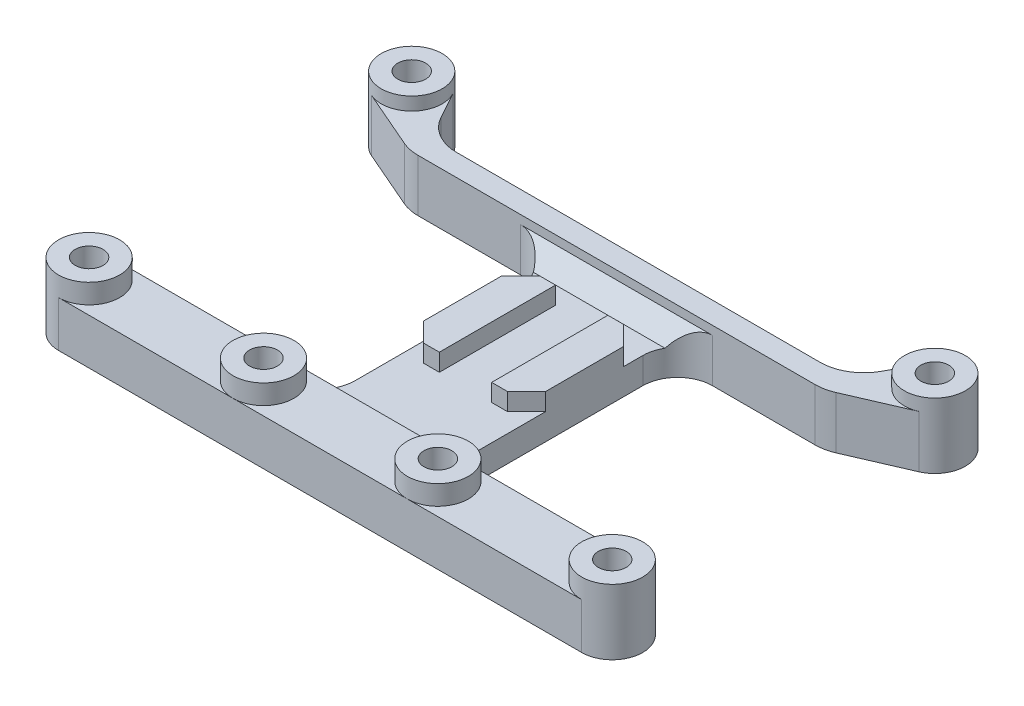
from build123d import *

# Parameters (mm, degrees)
SKETCH1_R           = 1.6000000000000016
SKETCH1_R_2         = 1.599999999999998
SKETCH1_R_3         = 1.6000000000000008
SKETCH1_R_4         = 1.5999999999999974
BOSS_EXTRUDE1_DEPTH = 3
SKETCH2_R           = 3.5
SKETCH2_R_2         = 1.6000000000000016
SKETCH2_R_3         = 3.5000000000000004
SKETCH2_R_4         = 1.599999999999998
SKETCH2_R_5         = 3.499999999999981
SKETCH2_R_6         = 1.600000000000006
SKETCH2_R_7         = 3.500000000000001
SKETCH2_R_8         = 1.600000000000004
BOSS_EXTRUDE2_DEPTH = 4.5
SKETCH3_W           = 3.9999999999999867
SKETCH3_H           = 13.329420100260858
SKETCH3_W_2         = 4.000000000000002
BOSS_EXTRUDE3_DEPTH = 2
BOSS_EXTRUDE4_DEPTH = 3
CHAMFER1_SIZE       = 2.2
BOSS_EXTRUDE5_DEPTH = 2.25
CHAMFER2_SIZE       = 2


with BuildPart() as part:
    # Sketch1 → Boss-Extrude1 (new body)
    with BuildSketch(Plane(origin=(0, 0, 0), x_dir=(1, 0, 0), z_dir=(0, 1, 0))):
        with BuildLine():
            Line((30, 3.4999999999999893), (11.000000000000055, 3.4999999999999787))
            ThreePointArc((11.000000000000055, 3.4999999999999787), (8.17157287525383, 4.671572875253764), (7.000000000000055, 7.499999999999969))
            Line((7.000000000000055, 7.499999999999969), (7.000000000000005, 26.500174631387697))
            ThreePointArc((7.000000000000005, 26.500174631387697), (8.171592159792695, 29.328621040541247), (11.000054544726876, 30.500174631015817))
            Line((11.000054544726876, 30.500174631015817), (22.766928336279094, 30.500014175786525))
            ThreePointArc((22.766928336279094, 30.500014175786525), (23.78226917988397, 30.604177023170642), (24.755302924194492, 30.912352719649913))
            Line((24.755302924194492, 30.912352719649913), (31.391682197706423, 33.78857965059265))
            ThreePointArc((31.391682197706423, 33.78857965059265), (32.588411097920776, 39.35587096169569), (26.933374391160406, 38.68695209629931))
            Line((26.933374391160406, 38.68695209629931), (25.229799512359598, 35.59010876484576))
            ThreePointArc((25.229799512359598, 35.59010876484576), (23.393512186944445, 33.69597501300612), (20.848837604537206, 33.00004033145261))
            Line((20.848837604537206, 33.00004033145261), (-20.849286755225446, 33.000608934653826))
            ThreePointArc((-20.849286755225446, 33.000608934653826), (-23.393883666595727, 33.69657831532278), (-25.23011230123065, 35.590677368046975))
            Line((-25.23011230123065, 35.590677368046975), (-26.93337439116037, 38.68695209629936))
            ThreePointArc((-26.93337439116037, 38.68695209629936), (-32.58841109792075, 39.35587096169563), (-31.39168219770639, 33.78857965059271))
            Line((-31.39168219770639, 33.78857965059271), (-24.756735607602185, 30.91297364898972))
            ThreePointArc((-24.756735607602185, 30.91297364898972), (-23.783768623722317, 30.604811797408143), (-22.768497381503924, 30.500635105126253))
            Line((-22.768497381503924, 30.500635105126253), (-10.999945455273123, 30.50047462701362))
            ThreePointArc((-10.999945455273123, 30.50047462701362), (-8.171553590846381, 29.32888246759283), (-6.9999999999999645, 26.500474627385458))
            Line((-6.9999999999999645, 26.500474627385458), (-6.999999999999992, 7.500000000000007))
            ThreePointArc((-6.999999999999992, 7.500000000000007), (-8.171572875253794, 4.671572875253782), (-11.000000000000023, 3.499999999999975))
            Line((-11.000000000000023, 3.499999999999975), (-30, 3.500000000000003))
            ThreePointArc((-30, 3.500000000000003), (-33.5, 4.3e-16), (-30, -3.500000000000003))
            Line((-30, -3.500000000000003), (30, -3.500000000000017))
            ThreePointArc((30, -3.500000000000017), (33.500000000000014, 0), (30, 3.4999999999999893))
        make_face()
        with Locations((-30, 0)):
            Circle(SKETCH1_R, mode=Mode.SUBTRACT)
        with Locations((-9.999999999999998, -4.9e-15)):
            Circle(SKETCH1_R, mode=Mode.SUBTRACT)
        with Locations((10.000000000000002, -2.45e-15)):
            Circle(SKETCH1_R, mode=Mode.SUBTRACT)
        with Locations((30, 0)):
            Circle(SKETCH1_R_2, mode=Mode.SUBTRACT)
        with Locations((-30.000000000000014, 36.999999999999986)):
            Circle(SKETCH1_R_3, mode=Mode.SUBTRACT)
        with Locations((30, 36.999999999999986)):
            Circle(SKETCH1_R_4, mode=Mode.SUBTRACT)
    extrude(amount=BOSS_EXTRUDE1_DEPTH)

    # Sketch2 → Boss-Extrude2 (add)
    # profile 1 of 6: a face of its own
    with BuildSketch(Plane(origin=(0, 3, 0), x_dir=(1, 0, 0), z_dir=(0, 1, 0))):
        with Locations((-30, 0)):
            Circle(SKETCH2_R)
        with Locations((-30, 0)):
            Circle(SKETCH2_R_2, mode=Mode.SUBTRACT)
    # profile 2 of 6: a face of its own
    with BuildSketch(Plane(origin=(0, 3, 0), x_dir=(1, 0, 0), z_dir=(0, 1, 0))):
        with Locations((-9.999999999999998, -4.9e-15)):
            Circle(SKETCH2_R)
        with Locations((-9.999999999999998, -4.9e-15)):
            Circle(SKETCH2_R_2, mode=Mode.SUBTRACT)
    # profile 3 of 6: a face of its own
    with BuildSketch(Plane(origin=(0, 3, 0), x_dir=(1, 0, 0), z_dir=(0, 1, 0))):
        with Locations((10.000000000000002, -2.45e-15)):
            Circle(SKETCH2_R)
        with Locations((10.000000000000002, -2.45e-15)):
            Circle(SKETCH2_R_2, mode=Mode.SUBTRACT)
    # profile 4 of 6: a face of its own
    with BuildSketch(Plane(origin=(0, 3, 0), x_dir=(1, 0, 0), z_dir=(0, 1, 0))):
        with Locations((30, 0)):
            Circle(SKETCH2_R_3)
        with Locations((30, 0)):
            Circle(SKETCH2_R_4, mode=Mode.SUBTRACT)
    # profile 5 of 6: a face of its own
    with BuildSketch(Plane(origin=(0, 3, 0), x_dir=(1, 0, 0), z_dir=(0, 1, 0))):
        with Locations((30, 36.999999999999986)):
            Circle(SKETCH2_R_5)
        with Locations((30, 36.999999999999986)):
            Circle(SKETCH2_R_6, mode=Mode.SUBTRACT)
    # profile 6 of 6: a face of its own
    with BuildSketch(Plane(origin=(0, 3, 0), x_dir=(1, 0, 0), z_dir=(0, 1, 0))):
        with Locations((-30.000000000000014, 36.999999999999986)):
            Circle(SKETCH2_R_7)
        with Locations((-30.000000000000014, 36.999999999999986)):
            Circle(SKETCH2_R_8, mode=Mode.SUBTRACT)
    extrude(amount=BOSS_EXTRUDE2_DEPTH)

    # Sketch3 → Boss-Extrude3 (add)
    with BuildSketch(Plane(origin=(0, 3, 0), x_dir=(1, 0, 0), z_dir=(0, 1, 0))):
        with Locations((-4.999999999999988, 19.83546458125727)):
            Rectangle(SKETCH3_W, SKETCH3_H)
        with Locations((4.99999999999998, 19.83546458125727)):
            Rectangle(SKETCH3_W_2, SKETCH3_H)
    extrude(amount=BOSS_EXTRUDE3_DEPTH)

    # Sketch4 → Boss-Extrude4 (add)
    with BuildSketch(Plane(origin=(0, 3, 0), x_dir=(1, 0, 0), z_dir=(0, 1, 0))):
        with BuildLine():
            Line((24.755302924194492, 30.912352719649913), (31.3916821977064, 33.788579650592716))
            ThreePointArc((31.3916821977064, 33.788579650592716), (27.411588902079316, 34.6441290383044), (26.933374391160438, 38.68695209629936))
            Line((26.933374391160438, 38.68695209629936), (25.229799512359598, 35.59010876484576))
            ThreePointArc((25.229799512359598, 35.59010876484576), (23.393512186944445, 33.69597501300612), (20.848837604537206, 33.00004033145261))
            Line((20.848837604537206, 33.00004033145261), (11.000054544726876, 33.00004033145261))
            Line((11.000054544726876, 33.00004033145261), (-10.999945455273123, 33.00060893465382))
            Line((-10.999945455273123, 33.00060893465382), (-20.849286755225446, 33.00060893465382))
            ThreePointArc((-20.849286755225446, 33.00060893465382), (-23.393883666595727, 33.69657831532278), (-25.23011230123065, 35.590677368046975))
            Line((-25.23011230123065, 35.590677368046975), (-26.93337439116037, 38.68695209629936))
            ThreePointArc((-26.93337439116037, 38.68695209629936), (-27.411588902079277, 34.64412903830434), (-31.39168219770639, 33.78857965059271))
            Line((-31.39168219770639, 33.78857965059271), (-24.756735607602185, 30.912973648989716))
            ThreePointArc((-24.756735607602185, 30.912973648989716), (-23.783768623722317, 30.60481179740814), (-22.768497381503924, 30.500635105126253))
            Line((-22.768497381503924, 30.500635105126253), (-10.999945455273123, 30.500474627013624))
            Line((-10.999945455273123, 30.500474627013624), (11.000054544726876, 30.500174631015817))
            Line((11.000054544726876, 30.500174631015817), (22.766928336279094, 30.500014175786497))
            ThreePointArc((22.766928336279094, 30.500014175786497), (23.78226917988396, 30.604177023170678), (24.755302924194492, 30.912352719649913))
        make_face()
    extrude(amount=BOSS_EXTRUDE4_DEPTH)

    # Chamfer1
    chamfer1_edges = [part.edges().sort_by_distance(p)[0] for p in [
        (-6.99999999999998, 4, -26.500174631387697),
        (6.99999999999998, 4, -26.500174631387697),
        (6.99999999999998, 4, -13.170754531126839),
        (-6.99999999999998, 4, -13.170754531126839),
    ]]
    chamfer(chamfer1_edges, length=CHAMFER1_SIZE)

    # Sketch5 → Boss-Extrude5 (add)
    with BuildSketch(Plane(origin=(0, 3, 0), x_dir=(1, 0, 0), z_dir=(0, 1, 0))):
        with BuildLine():
            Line((-9.999999992545956, 3.499999999999997), (-30, 3.5000000000000036))
            ThreePointArc((-30, 3.5000000000000036), (-26.5, 1.78e-15), (-30, -3.500000000000001))
            Line((-30, -3.5), (-10, -3.5))
            ThreePointArc((-9.999999999999998, -3.500000000000005), (-13.499999999999998, 3.72701556e-09), (-9.999999992545956, 3.499999999999995))
        make_face()
        with BuildLine():
            Line((10.000000006260862, 3.499999999999994), (-9.999999992545956, 3.4999999999999987))
            ThreePointArc((-9.999999992545956, 3.499999999999995), (-6.499999999999998, -3.72702582e-09), (-9.999999999999998, -3.500000000000005))
            Line((-10, -3.5), (10, -3.5))
            ThreePointArc((10.000000000000004, -3.5000000000000027), (6.500000000000002, 3.13042789e-09), (10.000000006260864, 3.4999999999999973))
        make_face()
        with BuildLine():
            Line((29.999999999999996, 3.499999999999989), (10.000000006260866, 3.4999999999999956))
            ThreePointArc((10.000000006260864, 3.4999999999999973), (13.500000000000002, -3.13043359e-09), (10.000000000000002, -3.5000000000000027))
            Line((10, -3.5), (30, -3.5))
            ThreePointArc((30, -3.5000000000000013), (26.50000000000001, -8.11e-15), (29.999999999999996, 3.499999999999989))
        make_face()
    extrude(amount=BOSS_EXTRUDE5_DEPTH)

    # Chamfer2
    chamfer2_edges = [part.edges().sort_by_distance(p)[0] for p in [
        (1.599e-14, 3, -3.499999999999977),
        (5.45447268756e-05, 3, -30.5003246290147),
    ]]
    chamfer(chamfer2_edges, length=CHAMFER2_SIZE)


solid = part.part
